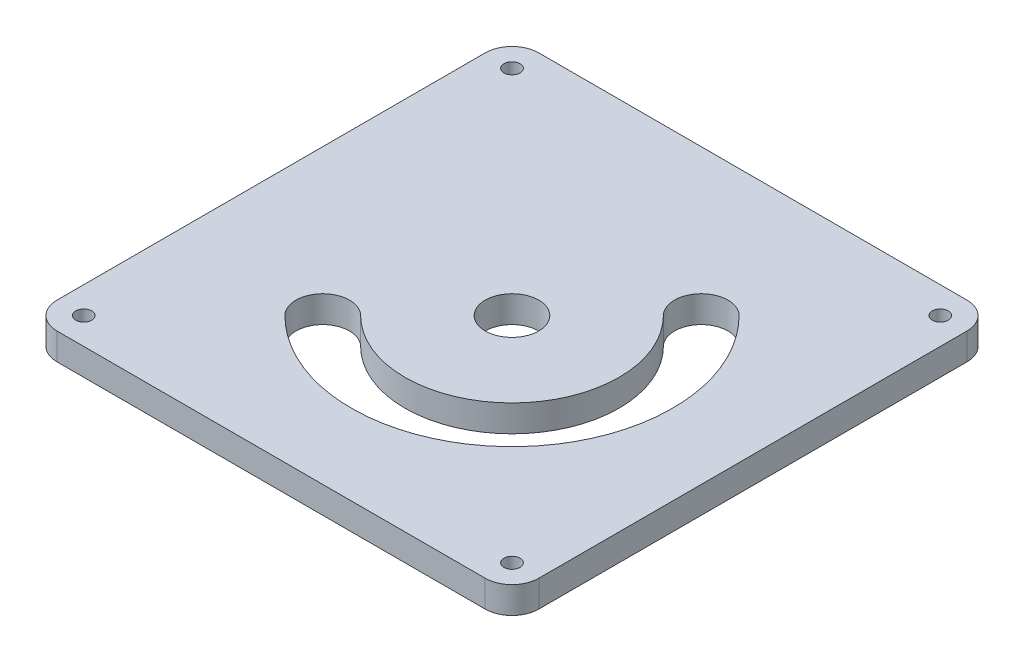
from build123d import *

# Parameters (mm, degrees)
SKETCH1_W           = 90
SKETCH1_H           = 90
SKETCH1_R           = 5
BOSS_EXTRUDE1_DEPTH = 5
SKETCH2_R           = 1.5
CUT_EXTRUDE1_DEPTH  = 64.835726674
FILLET1_R           = 5


with BuildPart() as part:
    # Sketch1 → Boss-Extrude1 (new body)
    with BuildSketch(Plane(origin=(0, 0, 0), x_dir=(1, 0, 0), z_dir=(0, 1, 0))):
        Rectangle(SKETCH1_W, SKETCH1_H)
        Circle(SKETCH1_R, mode=Mode.SUBTRACT)
        with BuildLine():
            ThreePointArc((-21.213203436, -21.213203436), (21.213203436, -21.213203436), (21.213203436, 21.213203436))
            ThreePointArc((21.213203436, 21.213203436), (14.142135624, 21.213203436), (14.142135624, 14.142135624))
            ThreePointArc((14.142135624, 14.142135624), (14.142135624, -14.142135624), (-14.142135624, -14.142135624))
            ThreePointArc((-14.142135624, -14.142135624), (-21.213203436, -14.142135624), (-21.213203436, -21.213203436))
        make_face(mode=Mode.SUBTRACT)
    extrude(amount=BOSS_EXTRUDE1_DEPTH)

    # Sketch2 → Cut-Extrude1 (cut, through all)
    with BuildSketch(Plane(origin=(0, 5, 0), x_dir=(1, 0, 0), z_dir=(0, 1, 0))):
        with Locations((-40, 40)):
            Circle(SKETCH2_R)
        with Locations((40, 40)):
            Circle(SKETCH2_R)
        with Locations((40, -40)):
            Circle(SKETCH2_R)
        with Locations((-40, -40)):
            Circle(SKETCH2_R)
    extrude(amount=-CUT_EXTRUDE1_DEPTH, mode=Mode.SUBTRACT)

    # Fillet1
    fillet1_edges = [part.edges().sort_by_distance(p)[0] for p in [
        (-45, 2.5, 45),
        (-45, 2.5, -45),
        (45, 2.5, 45),
        (45, 2.5, -45),
    ]]
    fillet(fillet1_edges, radius=FILLET1_R)


solid = part.part
